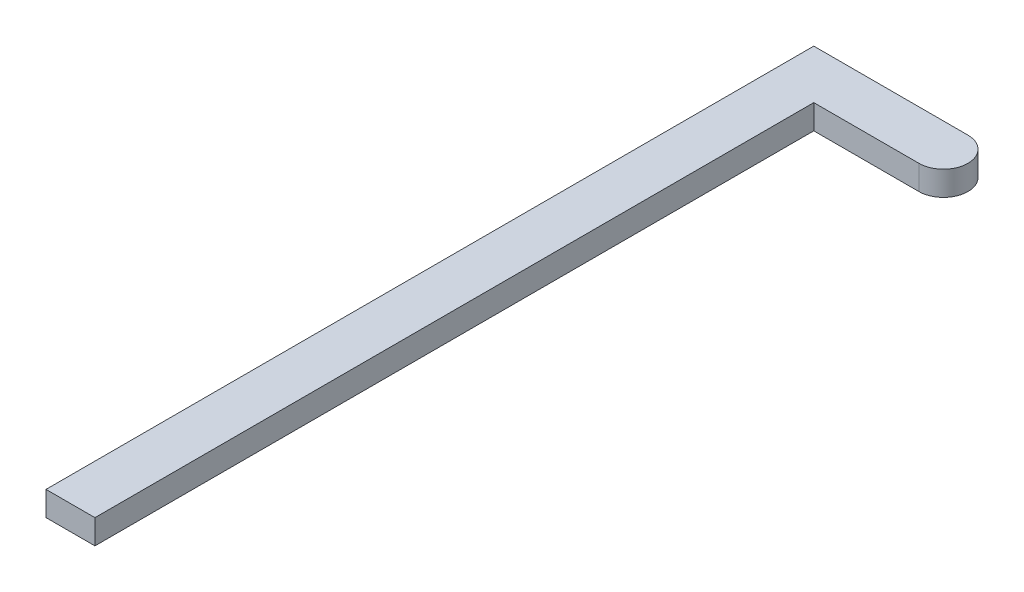
from build123d import *

# Parameters (mm, degrees)
BOSS_EXTRUDE1_DEPTH = 6.35


with BuildPart() as part:
    # Sketch1 → Boss-Extrude1 (new body)
    with BuildSketch(Plane(origin=(0, 0, 0), x_dir=(1, 0, 0), z_dir=(0, 1, 0))):
        with BuildLine():
            Line((0, 6.35), (-40, 6.35))
            Line((-40, 6.35), (-40, -192.896))
            Line((-40, -192.896), (-27.3, -192.896))
            Line((-27.3, -192.896), (-27.3, -6.35))
            Line((-27.3, -6.35), (0, -6.35))
            ThreePointArc((0, -6.35), (6.35, 0), (0, 6.35))
        make_face()
    extrude(amount=BOSS_EXTRUDE1_DEPTH)


solid = part.part
